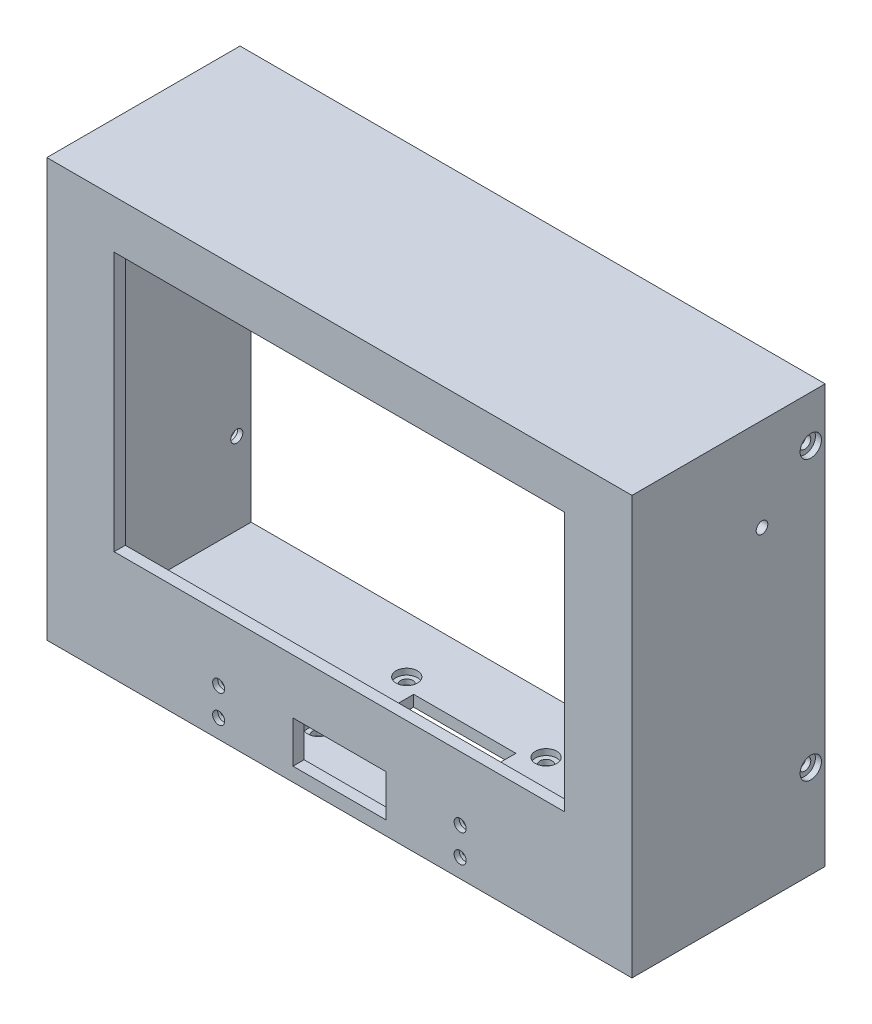
from build123d import *

# Parameters (mm, degrees)
BOSS_EXTRUDE1_START  = 38.4
SKETCH1_W            = 126
SKETCH1_H            = 90
BOSS_EXTRUDE1_DEPTH  = 41.6
BOSS_EXTRUDE2_START  = 36
SKETCH2_W            = 121.2
SKETCH2_H            = 85.2
BOSS_EXTRUDE2_DEPTH  = 41.6
BOSS_EXTRUDE3_START  = 76.6
SKETCH3_W            = 97
SKETCH3_H            = 55.86
BOSS_EXTRUDE3_DEPTH  = 4.4
BOSS_EXTRUDE4_START  = 73.1
SKETCH4_R            = 2.8
BOSS_EXTRUDE4_DEPTH  = 4.5
BOSS_EXTRUDE5_START  = 72.1
SKETCH5_R            = 1
BOSS_EXTRUDE5_DEPTH  = 7.1
BOSS_EXTRUDE6_START  = 73.1
SKETCH6_R            = 2.8
BOSS_EXTRUDE6_DEPTH  = 4.5
BOSS_EXTRUDE7_START  = 72.1
SKETCH7_R            = 1
BOSS_EXTRUDE7_DEPTH  = 7.1
BOSS_EXTRUDE8_START  = 73.1
SKETCH8_R            = 2.8
BOSS_EXTRUDE8_DEPTH  = 4.5
BOSS_EXTRUDE9_START  = 72.1
SKETCH9_R            = 1
BOSS_EXTRUDE9_DEPTH  = 7.1
BOSS_EXTRUDE10_START = 73.1
SKETCH10_R           = 2.8
BOSS_EXTRUDE10_DEPTH = 4.5
BOSS_EXTRUDE11_START = 72.1
SKETCH11_R           = 1
BOSS_EXTRUDE11_DEPTH = 7.1
BOSS_EXTRUDE12_START = 65.9
SKETCH12_W           = 3.9
SKETCH12_H           = 14
BOSS_EXTRUDE12_DEPTH = 8
BOSS_EXTRUDE13_START = -60.6
SKETCH13_R           = 8.3
BOSS_EXTRUDE13_DEPTH = 1.2
BOSS_EXTRUDE14_START = -60.6
SKETCH14_R           = 7.3
BOSS_EXTRUDE14_DEPTH = 1.3
BOSS_EXTRUDE15_START = -64
SKETCH15_R           = 1.25
BOSS_EXTRUDE15_DEPTH = 4.4
BOSS_EXTRUDE16_START = -64
SKETCH16_R           = 1.3
BOSS_EXTRUDE16_DEPTH = 4.4
BOSS_EXTRUDE17_START = -64
SKETCH17_R           = 2.3
BOSS_EXTRUDE17_DEPTH = 2.3
BOSS_EXTRUDE18_START = -64
SKETCH18_R           = 1.3
BOSS_EXTRUDE18_DEPTH = 4.4
BOSS_EXTRUDE19_START = -64
SKETCH19_R           = 2.3
BOSS_EXTRUDE19_DEPTH = 2.3
BOSS_EXTRUDE20_START = 59.4
SKETCH20_R           = 8.3
BOSS_EXTRUDE20_DEPTH = 1.2
BOSS_EXTRUDE21_START = 59.3
SKETCH21_R           = 7.3
BOSS_EXTRUDE21_DEPTH = 1.3
BOSS_EXTRUDE22_START = 59.6
SKETCH22_R           = 1.25
BOSS_EXTRUDE22_DEPTH = 4.4
BOSS_EXTRUDE23_START = 59.6
SKETCH23_R           = 1.3
BOSS_EXTRUDE23_DEPTH = 4.4
BOSS_EXTRUDE24_START = 61.7
SKETCH24_R           = 2.3
BOSS_EXTRUDE24_DEPTH = 2.3
BOSS_EXTRUDE25_START = 59.6
SKETCH25_R           = 1.3
BOSS_EXTRUDE25_DEPTH = 4.4
BOSS_EXTRUDE26_START = 61.7
SKETCH26_R           = 2.3
BOSS_EXTRUDE26_DEPTH = 2.3
BOSS_EXTRUDE27_START = 53
SKETCH27_W           = 22
SKETCH27_H           = 4.4
BOSS_EXTRUDE27_DEPTH = 14
BOSS_EXTRUDE28_START = 59
SKETCH28_R           = 1.3
BOSS_EXTRUDE28_DEPTH = 4.4
BOSS_EXTRUDE29_START = 61.1
SKETCH29_R           = 2.3
BOSS_EXTRUDE29_DEPTH = 1.8
BOSS_EXTRUDE30_START = 59
SKETCH30_R           = 1.3
BOSS_EXTRUDE30_DEPTH = 4.4
BOSS_EXTRUDE31_START = 61.1
SKETCH31_R           = 2.3
BOSS_EXTRUDE31_DEPTH = 1.8
BOSS_EXTRUDE32_START = 59
SKETCH32_R           = 1.3
BOSS_EXTRUDE32_DEPTH = 4.4
BOSS_EXTRUDE33_START = 61.1
SKETCH33_R           = 2.3
BOSS_EXTRUDE33_DEPTH = 1.8
BOSS_EXTRUDE34_START = 59
SKETCH34_R           = 1.3
BOSS_EXTRUDE34_DEPTH = 4.4
BOSS_EXTRUDE35_START = 61.1
SKETCH35_R           = 2.3
BOSS_EXTRUDE35_DEPTH = 1.8
BOSS_EXTRUDE36_START = 76.6
SKETCH36_W           = 20
SKETCH36_H           = 9
BOSS_EXTRUDE36_DEPTH = 4.4
BOSS_EXTRUDE37_START = 76.6
SKETCH37_R           = 1.3
BOSS_EXTRUDE37_DEPTH = 4.4
BOSS_EXTRUDE38_START = 77.1
SKETCH38_R           = 2.3
BOSS_EXTRUDE38_DEPTH = 1.8
BOSS_EXTRUDE39_START = 76.6
SKETCH39_R           = 1.3
BOSS_EXTRUDE39_DEPTH = 4.4
BOSS_EXTRUDE40_START = 77.1
SKETCH40_R           = 2.3
BOSS_EXTRUDE40_DEPTH = 1.8
BOSS_EXTRUDE41_START = 76.6
SKETCH41_R           = 1.3
BOSS_EXTRUDE41_DEPTH = 4.4
BOSS_EXTRUDE42_START = 77.1
SKETCH42_R           = 2.3
BOSS_EXTRUDE42_DEPTH = 1.8
BOSS_EXTRUDE43_START = 76.6
SKETCH43_R           = 1.3
BOSS_EXTRUDE43_DEPTH = 4.4
BOSS_EXTRUDE44_START = 77.1
SKETCH44_R           = 2.3
BOSS_EXTRUDE44_DEPTH = 1.8


with BuildPart() as part:
    # Sketch1 → Boss-Extrude1 (new body)
    with BuildSketch(Plane.XY.offset(BOSS_EXTRUDE1_START)):
        with Locations((0, 105)):
            Rectangle(SKETCH1_W, SKETCH1_H)
    extrude(amount=BOSS_EXTRUDE1_DEPTH)


with BuildPart() as body_2:
    # Sketch2 → Boss-Extrude2 (new body)
    with BuildSketch(Plane.XY.offset(BOSS_EXTRUDE2_START)):
        with Locations((0, 105)):
            Rectangle(SKETCH2_W, SKETCH2_H)
    extrude(amount=BOSS_EXTRUDE2_DEPTH)


with BuildPart() as part_1:
    add(part.part)

    # Combine1: cut body 2
    add(body_2.part, mode=Mode.SUBTRACT)


with BuildPart() as body_2_2:
    # Sketch3 → Boss-Extrude3 (new body)
    with BuildSketch(Plane.XY.offset(BOSS_EXTRUDE3_START)):
        with Locations((0, 111.67)):
            Rectangle(SKETCH3_W, SKETCH3_H)
    extrude(amount=BOSS_EXTRUDE3_DEPTH)


with BuildPart() as part_2:
    add(part_1.part)

    # Combine2: cut body 2 2
    add(body_2_2.part, mode=Mode.SUBTRACT)

    # Sketch4 → Boss-Extrude4 (add)
    with BuildSketch(Plane.XY.offset(BOSS_EXTRUDE4_START)):
        with Locations((-56.3, 78.45)):
            Circle(SKETCH4_R)
    extrude(amount=BOSS_EXTRUDE4_DEPTH)


with BuildPart() as body_2_3:
    # Sketch5 → Boss-Extrude5 (new body)
    with BuildSketch(Plane.XY.offset(BOSS_EXTRUDE5_START)):
        with Locations((-56.3, 78.45)):
            Circle(SKETCH5_R)
    extrude(amount=BOSS_EXTRUDE5_DEPTH)


with BuildPart() as part_3:
    add(part_2.part)

    # Combine3: cut body 2 3
    add(body_2_3.part, mode=Mode.SUBTRACT)

    # Sketch6 → Boss-Extrude6 (add)
    with BuildSketch(Plane.XY.offset(BOSS_EXTRUDE6_START)):
        with Locations((-56.3, 140.55)):
            Circle(SKETCH6_R)
    extrude(amount=BOSS_EXTRUDE6_DEPTH)


with BuildPart() as body_2_4:
    # Sketch7 → Boss-Extrude7 (new body)
    with BuildSketch(Plane.XY.offset(BOSS_EXTRUDE7_START)):
        with Locations((-56.3, 140.55)):
            Circle(SKETCH7_R)
    extrude(amount=BOSS_EXTRUDE7_DEPTH)


with BuildPart() as part_4:
    add(part_3.part)

    # Combine4: cut body 2 4
    add(body_2_4.part, mode=Mode.SUBTRACT)

    # Sketch8 → Boss-Extrude8 (add)
    with BuildSketch(Plane.XY.offset(BOSS_EXTRUDE8_START)):
        with Locations((56.3, 78.45)):
            Circle(SKETCH8_R)
    extrude(amount=BOSS_EXTRUDE8_DEPTH)


with BuildPart() as body_2_5:
    # Sketch9 → Boss-Extrude9 (new body)
    with BuildSketch(Plane.XY.offset(BOSS_EXTRUDE9_START)):
        with Locations((56.3, 78.45)):
            Circle(SKETCH9_R)
    extrude(amount=BOSS_EXTRUDE9_DEPTH)


with BuildPart() as part_5:
    add(part_4.part)

    # Combine5: cut body 2 5
    add(body_2_5.part, mode=Mode.SUBTRACT)

    # Sketch10 → Boss-Extrude10 (add)
    with BuildSketch(Plane.XY.offset(BOSS_EXTRUDE10_START)):
        with Locations((56.3, 140.55)):
            Circle(SKETCH10_R)
    extrude(amount=BOSS_EXTRUDE10_DEPTH)


with BuildPart() as body_2_6:
    # Sketch11 → Boss-Extrude11 (new body)
    with BuildSketch(Plane.XY.offset(BOSS_EXTRUDE11_START)):
        with Locations((56.3, 140.55)):
            Circle(SKETCH11_R)
    extrude(amount=BOSS_EXTRUDE11_DEPTH)


with BuildPart() as part_6:
    add(part_5.part)

    # Combine6: cut body 2 6
    add(body_2_6.part, mode=Mode.SUBTRACT)


with BuildPart() as body_2_7:
    # Sketch12 → Boss-Extrude12 (new body)
    with BuildSketch(Plane.XY.offset(BOSS_EXTRUDE12_START)):
        with Locations((-62.05, 114.5)):
            Rectangle(SKETCH12_W, SKETCH12_H)
    extrude(amount=BOSS_EXTRUDE12_DEPTH)


with BuildPart() as part_7:
    add(part_6.part)

    # Combine7: cut body 2 7
    add(body_2_7.part, mode=Mode.SUBTRACT)

    # Sketch13 → Boss-Extrude13 (add)
    with BuildSketch(Plane(origin=(0, 0, 0), x_dir=(0, 0, -1), z_dir=(1, 0, 0)).offset(BOSS_EXTRUDE13_START)):
        with Locations((-52, 130)):
            Circle(SKETCH13_R)
    extrude(amount=BOSS_EXTRUDE13_DEPTH)


with BuildPart() as body_2_8:
    # Sketch14 → Boss-Extrude14 (new body)
    with BuildSketch(Plane(origin=(0, 0, 0), x_dir=(0, 0, -1), z_dir=(1, 0, 0)).offset(BOSS_EXTRUDE14_START)):
        with Locations((-52, 130)):
            Circle(SKETCH14_R)
    extrude(amount=BOSS_EXTRUDE14_DEPTH)


with BuildPart() as part_8:
    add(part_7.part)

    # Combine8: cut body 2 8
    add(body_2_8.part, mode=Mode.SUBTRACT)


with BuildPart() as body_2_9:
    # Sketch15 → Boss-Extrude15 (new body)
    with BuildSketch(Plane(origin=(0, 0, 0), x_dir=(0, 0, -1), z_dir=(1, 0, 0)).offset(BOSS_EXTRUDE15_START)):
        with Locations((-52, 130)):
            Circle(SKETCH15_R)
    extrude(amount=BOSS_EXTRUDE15_DEPTH)


with BuildPart() as part_9:
    add(part_8.part)

    # Combine9: cut body 2 9
    add(body_2_9.part, mode=Mode.SUBTRACT)


with BuildPart() as body_2_10:
    # Sketch16 → Boss-Extrude16 (new body)
    with BuildSketch(Plane(origin=(0, 0, 0), x_dir=(0, 0, -1), z_dir=(1, 0, 0)).offset(BOSS_EXTRUDE16_START)):
        with Locations((-41.5, 80)):
            Circle(SKETCH16_R)
    extrude(amount=BOSS_EXTRUDE16_DEPTH)


with BuildPart() as part_10:
    add(part_9.part)

    # Combine10: cut body 2 10
    add(body_2_10.part, mode=Mode.SUBTRACT)


with BuildPart() as body_2_11:
    # Sketch17 → Boss-Extrude17 (new body)
    with BuildSketch(Plane(origin=(0, 0, 0), x_dir=(0, 0, -1), z_dir=(1, 0, 0)).offset(BOSS_EXTRUDE17_START)):
        with Locations((-41.5, 80)):
            Circle(SKETCH17_R)
    extrude(amount=BOSS_EXTRUDE17_DEPTH)


with BuildPart() as part_11:
    add(part_10.part)

    # Combine11: cut body 2 11
    add(body_2_11.part, mode=Mode.SUBTRACT)


with BuildPart() as body_2_12:
    # Sketch18 → Boss-Extrude18 (new body)
    with BuildSketch(Plane(origin=(0, 0, 0), x_dir=(0, 0, -1), z_dir=(1, 0, 0)).offset(BOSS_EXTRUDE18_START)):
        with Locations((-41.5, 140)):
            Circle(SKETCH18_R)
    extrude(amount=BOSS_EXTRUDE18_DEPTH)


with BuildPart() as part_12:
    add(part_11.part)

    # Combine12: cut body 2 12
    add(body_2_12.part, mode=Mode.SUBTRACT)


with BuildPart() as body_2_13:
    # Sketch19 → Boss-Extrude19 (new body)
    with BuildSketch(Plane(origin=(0, 0, 0), x_dir=(0, 0, -1), z_dir=(1, 0, 0)).offset(BOSS_EXTRUDE19_START)):
        with Locations((-41.5, 140)):
            Circle(SKETCH19_R)
    extrude(amount=BOSS_EXTRUDE19_DEPTH)


with BuildPart() as part_13:
    add(part_12.part)

    # Combine13: cut body 2 13
    add(body_2_13.part, mode=Mode.SUBTRACT)

    # Sketch20 → Boss-Extrude20 (add)
    with BuildSketch(Plane(origin=(0, 0, 0), x_dir=(0, 0, -1), z_dir=(1, 0, 0)).offset(BOSS_EXTRUDE20_START)):
        with Locations((-52, 130)):
            Circle(SKETCH20_R)
    extrude(amount=BOSS_EXTRUDE20_DEPTH)


with BuildPart() as body_2_14:
    # Sketch21 → Boss-Extrude21 (new body)
    with BuildSketch(Plane(origin=(0, 0, 0), x_dir=(0, 0, -1), z_dir=(1, 0, 0)).offset(BOSS_EXTRUDE21_START)):
        with Locations((-52, 130)):
            Circle(SKETCH21_R)
    extrude(amount=BOSS_EXTRUDE21_DEPTH)


with BuildPart() as part_14:
    add(part_13.part)

    # Combine14: cut body 2 14
    add(body_2_14.part, mode=Mode.SUBTRACT)


with BuildPart() as body_2_15:
    # Sketch22 → Boss-Extrude22 (new body)
    with BuildSketch(Plane(origin=(0, 0, 0), x_dir=(0, 0, -1), z_dir=(1, 0, 0)).offset(BOSS_EXTRUDE22_START)):
        with Locations((-52, 130)):
            Circle(SKETCH22_R)
    extrude(amount=BOSS_EXTRUDE22_DEPTH)


with BuildPart() as part_15:
    add(part_14.part)

    # Combine15: cut body 2 15
    add(body_2_15.part, mode=Mode.SUBTRACT)


with BuildPart() as body_2_16:
    # Sketch23 → Boss-Extrude23 (new body)
    with BuildSketch(Plane(origin=(0, 0, 0), x_dir=(0, 0, -1), z_dir=(1, 0, 0)).offset(BOSS_EXTRUDE23_START)):
        with Locations((-41.5, 80)):
            Circle(SKETCH23_R)
    extrude(amount=BOSS_EXTRUDE23_DEPTH)


with BuildPart() as part_16:
    add(part_15.part)

    # Combine16: cut body 2 16
    add(body_2_16.part, mode=Mode.SUBTRACT)


with BuildPart() as body_2_17:
    # Sketch24 → Boss-Extrude24 (new body)
    with BuildSketch(Plane(origin=(0, 0, 0), x_dir=(0, 0, -1), z_dir=(1, 0, 0)).offset(BOSS_EXTRUDE24_START)):
        with Locations((-41.5, 80)):
            Circle(SKETCH24_R)
    extrude(amount=BOSS_EXTRUDE24_DEPTH)


with BuildPart() as part_17:
    add(part_16.part)

    # Combine17: cut body 2 17
    add(body_2_17.part, mode=Mode.SUBTRACT)


with BuildPart() as body_2_18:
    # Sketch25 → Boss-Extrude25 (new body)
    with BuildSketch(Plane(origin=(0, 0, 0), x_dir=(0, 0, -1), z_dir=(1, 0, 0)).offset(BOSS_EXTRUDE25_START)):
        with Locations((-41.5, 140)):
            Circle(SKETCH25_R)
    extrude(amount=BOSS_EXTRUDE25_DEPTH)


with BuildPart() as part_18:
    add(part_17.part)

    # Combine18: cut body 2 18
    add(body_2_18.part, mode=Mode.SUBTRACT)


with BuildPart() as body_2_19:
    # Sketch26 → Boss-Extrude26 (new body)
    with BuildSketch(Plane(origin=(0, 0, 0), x_dir=(0, 0, -1), z_dir=(1, 0, 0)).offset(BOSS_EXTRUDE26_START)):
        with Locations((-41.5, 140)):
            Circle(SKETCH26_R)
    extrude(amount=BOSS_EXTRUDE26_DEPTH)


with BuildPart() as part_19:
    add(part_18.part)

    # Combine19: cut body 2 19
    add(body_2_19.part, mode=Mode.SUBTRACT)


with BuildPart() as body_2_20:
    # Sketch27 → Boss-Extrude27 (new body)
    with BuildSketch(Plane.XY.offset(BOSS_EXTRUDE27_START)):
        with Locations((0, 61.2)):
            Rectangle(SKETCH27_W, SKETCH27_H)
    extrude(amount=BOSS_EXTRUDE27_DEPTH)


with BuildPart() as part_20:
    add(part_19.part)

    # Combine20: cut body 2 20
    add(body_2_20.part, mode=Mode.SUBTRACT)


with BuildPart() as body_2_21:
    # Sketch28 → Boss-Extrude28 (new body)
    with BuildSketch(Plane(origin=(0, 0, 0), x_dir=(1, 0, 0), z_dir=(0, 1, 0)).offset(BOSS_EXTRUDE28_START)):
        with Locations((-15, -50.5)):
            Circle(SKETCH28_R)
    extrude(amount=BOSS_EXTRUDE28_DEPTH)


with BuildPart() as part_21:
    add(part_20.part)

    # Combine21: cut body 2 21
    add(body_2_21.part, mode=Mode.SUBTRACT)


with BuildPart() as body_2_22:
    # Sketch29 → Boss-Extrude29 (new body)
    with BuildSketch(Plane(origin=(0, 0, 0), x_dir=(1, 0, 0), z_dir=(0, 1, 0)).offset(BOSS_EXTRUDE29_START)):
        with Locations((-15, -50.5)):
            Circle(SKETCH29_R)
    extrude(amount=BOSS_EXTRUDE29_DEPTH)


with BuildPart() as part_22:
    add(part_21.part)

    # Combine22: cut body 2 22
    add(body_2_22.part, mode=Mode.SUBTRACT)


with BuildPart() as body_2_23:
    # Sketch30 → Boss-Extrude30 (new body)
    with BuildSketch(Plane(origin=(0, 0, 0), x_dir=(1, 0, 0), z_dir=(0, 1, 0)).offset(BOSS_EXTRUDE30_START)):
        with Locations((-15, -69.5)):
            Circle(SKETCH30_R)
    extrude(amount=BOSS_EXTRUDE30_DEPTH)


with BuildPart() as part_23:
    add(part_22.part)

    # Combine23: cut body 2 23
    add(body_2_23.part, mode=Mode.SUBTRACT)


with BuildPart() as body_2_24:
    # Sketch31 → Boss-Extrude31 (new body)
    with BuildSketch(Plane(origin=(0, 0, 0), x_dir=(1, 0, 0), z_dir=(0, 1, 0)).offset(BOSS_EXTRUDE31_START)):
        with Locations((-15, -69.5)):
            Circle(SKETCH31_R)
    extrude(amount=BOSS_EXTRUDE31_DEPTH)


with BuildPart() as part_24:
    add(part_23.part)

    # Combine24: cut body 2 24
    add(body_2_24.part, mode=Mode.SUBTRACT)


with BuildPart() as body_2_25:
    # Sketch32 → Boss-Extrude32 (new body)
    with BuildSketch(Plane(origin=(0, 0, 0), x_dir=(1, 0, 0), z_dir=(0, 1, 0)).offset(BOSS_EXTRUDE32_START)):
        with Locations((15, -50.5)):
            Circle(SKETCH32_R)
    extrude(amount=BOSS_EXTRUDE32_DEPTH)


with BuildPart() as part_25:
    add(part_24.part)

    # Combine25: cut body 2 25
    add(body_2_25.part, mode=Mode.SUBTRACT)


with BuildPart() as body_2_26:
    # Sketch33 → Boss-Extrude33 (new body)
    with BuildSketch(Plane(origin=(0, 0, 0), x_dir=(1, 0, 0), z_dir=(0, 1, 0)).offset(BOSS_EXTRUDE33_START)):
        with Locations((15, -50.5)):
            Circle(SKETCH33_R)
    extrude(amount=BOSS_EXTRUDE33_DEPTH)


with BuildPart() as part_26:
    add(part_25.part)

    # Combine26: cut body 2 26
    add(body_2_26.part, mode=Mode.SUBTRACT)


with BuildPart() as body_2_27:
    # Sketch34 → Boss-Extrude34 (new body)
    with BuildSketch(Plane(origin=(0, 0, 0), x_dir=(1, 0, 0), z_dir=(0, 1, 0)).offset(BOSS_EXTRUDE34_START)):
        with Locations((15, -69.5)):
            Circle(SKETCH34_R)
    extrude(amount=BOSS_EXTRUDE34_DEPTH)


with BuildPart() as part_27:
    add(part_26.part)

    # Combine27: cut body 2 27
    add(body_2_27.part, mode=Mode.SUBTRACT)


with BuildPart() as body_2_28:
    # Sketch35 → Boss-Extrude35 (new body)
    with BuildSketch(Plane(origin=(0, 0, 0), x_dir=(1, 0, 0), z_dir=(0, 1, 0)).offset(BOSS_EXTRUDE35_START)):
        with Locations((15, -69.5)):
            Circle(SKETCH35_R)
    extrude(amount=BOSS_EXTRUDE35_DEPTH)


with BuildPart() as part_28:
    add(part_27.part)

    # Combine28: cut body 2 28
    add(body_2_28.part, mode=Mode.SUBTRACT)


with BuildPart() as body_2_29:
    # Sketch36 → Boss-Extrude36 (new body)
    with BuildSketch(Plane.XY.offset(BOSS_EXTRUDE36_START)):
        with Locations((0, 67.5)):
            Rectangle(SKETCH36_W, SKETCH36_H)
    extrude(amount=BOSS_EXTRUDE36_DEPTH)


with BuildPart() as part_29:
    add(part_28.part)

    # Combine29: cut body 2 29
    add(body_2_29.part, mode=Mode.SUBTRACT)


with BuildPart() as body_2_30:
    # Sketch37 → Boss-Extrude37 (new body)
    with BuildSketch(Plane.XY.offset(BOSS_EXTRUDE37_START)):
        with Locations((-26, 64)):
            Circle(SKETCH37_R)
    extrude(amount=BOSS_EXTRUDE37_DEPTH)


with BuildPart() as part_30:
    add(part_29.part)

    # Combine30: cut body 2 30
    add(body_2_30.part, mode=Mode.SUBTRACT)


with BuildPart() as body_2_31:
    # Sketch38 → Boss-Extrude38 (new body)
    with BuildSketch(Plane.XY.offset(BOSS_EXTRUDE38_START)):
        with Locations((-26, 64)):
            Circle(SKETCH38_R)
    extrude(amount=BOSS_EXTRUDE38_DEPTH)


with BuildPart() as part_31:
    add(part_30.part)

    # Combine31: cut body 2 31
    add(body_2_31.part, mode=Mode.SUBTRACT)


with BuildPart() as body_2_32:
    # Sketch39 → Boss-Extrude39 (new body)
    with BuildSketch(Plane.XY.offset(BOSS_EXTRUDE39_START)):
        with Locations((-26, 70)):
            Circle(SKETCH39_R)
    extrude(amount=BOSS_EXTRUDE39_DEPTH)


with BuildPart() as part_32:
    add(part_31.part)

    # Combine32: cut body 2 32
    add(body_2_32.part, mode=Mode.SUBTRACT)


with BuildPart() as body_2_33:
    # Sketch40 → Boss-Extrude40 (new body)
    with BuildSketch(Plane.XY.offset(BOSS_EXTRUDE40_START)):
        with Locations((-26, 70)):
            Circle(SKETCH40_R)
    extrude(amount=BOSS_EXTRUDE40_DEPTH)


with BuildPart() as part_33:
    add(part_32.part)

    # Combine33: cut body 2 33
    add(body_2_33.part, mode=Mode.SUBTRACT)


with BuildPart() as body_2_34:
    # Sketch41 → Boss-Extrude41 (new body)
    with BuildSketch(Plane.XY.offset(BOSS_EXTRUDE41_START)):
        with Locations((26, 64)):
            Circle(SKETCH41_R)
    extrude(amount=BOSS_EXTRUDE41_DEPTH)


with BuildPart() as part_34:
    add(part_33.part)

    # Combine34: cut body 2 34
    add(body_2_34.part, mode=Mode.SUBTRACT)


with BuildPart() as body_2_35:
    # Sketch42 → Boss-Extrude42 (new body)
    with BuildSketch(Plane.XY.offset(BOSS_EXTRUDE42_START)):
        with Locations((26, 64)):
            Circle(SKETCH42_R)
    extrude(amount=BOSS_EXTRUDE42_DEPTH)


with BuildPart() as part_35:
    add(part_34.part)

    # Combine35: cut body 2 35
    add(body_2_35.part, mode=Mode.SUBTRACT)


with BuildPart() as body_2_36:
    # Sketch43 → Boss-Extrude43 (new body)
    with BuildSketch(Plane.XY.offset(BOSS_EXTRUDE43_START)):
        with Locations((26, 70)):
            Circle(SKETCH43_R)
    extrude(amount=BOSS_EXTRUDE43_DEPTH)


with BuildPart() as part_36:
    add(part_35.part)

    # Combine36: cut body 2 36
    add(body_2_36.part, mode=Mode.SUBTRACT)


with BuildPart() as body_2_37:
    # Sketch44 → Boss-Extrude44 (new body)
    with BuildSketch(Plane.XY.offset(BOSS_EXTRUDE44_START)):
        with Locations((26, 70)):
            Circle(SKETCH44_R)
    extrude(amount=BOSS_EXTRUDE44_DEPTH)


with BuildPart() as part_37:
    add(part_36.part)

    # Combine37: cut body 2 37
    add(body_2_37.part, mode=Mode.SUBTRACT)


solid = part_37.part
